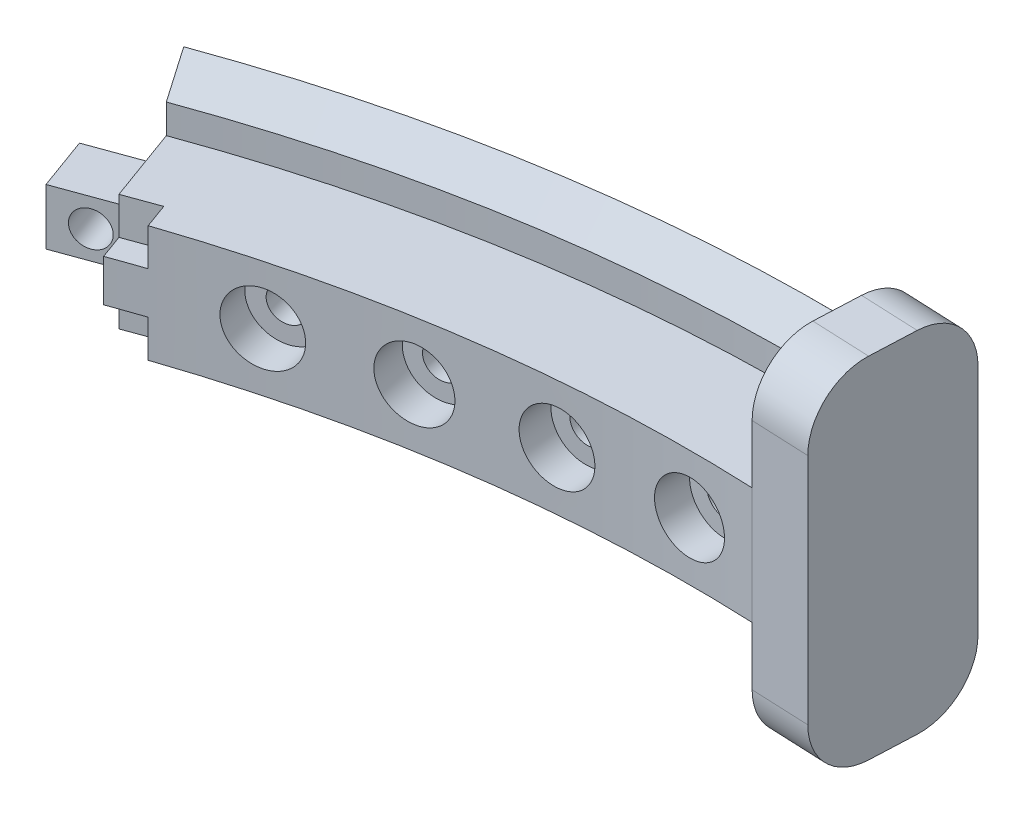
from build123d import *

# Parameters (mm, degrees)
REVOLVE_1_ANGLE          = 40
SKETCH_4_W               = 4.8
SKETCH_4_H               = 4.8
EXTRUDE_1_DEPTH          = 6
SKETCH_7_R               = 1.5
CUT_EXTRUDE_4_DEPTH      = 95.895882206
SKETCH_13_R              = 1.5
CUT_EXTRUDE_7_DEPTH      = 57.80711304
CUT_EXTRUDE_8_DEPTH      = 5
SKETCH_16_W              = 3
SKETCH_16_H              = 3
PATTERN_CIRCULAR_1_COUNT = 4
PATTERN_CIRCULAR_1_ANGLE = 15
SKETCH_10_W              = 2.2
SKETCH_10_H              = 5.2
CUT_EXTRUDE_5_DEPTH      = 3
SKETCH_11_W              = 47.375376564
SKETCH_11_H              = 32.407082742
CUT_EXTRUDE_6_DEPTH      = 149.607349927
SKETCH_12_W              = 14
SKETCH_12_H              = 30
EXTRUDE_2_DEPTH          = 5
FILLET_1_R               = 5


# Read off the part's stored shape, not the designer's step: 旋转1
with BuildPart() as part:
    # 旋转1 outline → 旋转1 (revolve)
    with BuildSketch(Plane(origin=(0, 0, 0), x_dir=(0.3420201433256701, 0, -0.9396926207859079), z_dir=(0.9396926207859079, 0, 0.3420201433256701))):
        Polygon((134, 5), (125, 5), (125, -5), (134, -5), (134, -7.5), (136.5, -10), (139, -7.5), (139, 7.5), (136.5, 10), (134, 7.5), align=None)
    revolve(axis=Axis((0, 0, 0), (0, 1, 0)), revolution_arc=REVOLVE_1_ANGLE)

    # 草图4 → 凸台-拉伸1 (add)
    with BuildSketch(Plane(origin=(0, 0, 0), x_dir=(0.3420201433256631, 0, 0.9396926207859104), z_dir=(-0.9396926207859104, 0, 0.3420201433256631))):
        with Locations((-132, 0)):
            Rectangle(SKETCH_4_W, SKETCH_4_H)
    extrude(amount=EXTRUDE_1_DEPTH)

    # 草图7 → 切除-拉伸4 (cut, through all)
    with BuildSketch(Plane(origin=(-45.967507263, 0, -126.294688234), x_dir=(-0.9396926207859105, 0, 0.3420201433256632), z_dir=(-0.3420201433256632, 0, -0.9396926207859105))):
        with Locations((3, 0)):
            Circle(SKETCH_7_R)
    extrude(amount=-CUT_EXTRUDE_4_DEPTH, mode=Mode.SUBTRACT)

    # 草图13 → 切除-拉伸7 (cut, through all)
    with BuildSketch(Plane(origin=(0, 0, -139), x_dir=(-1, 0, 0), z_dir=(0, 0, -1))):
        Circle(SKETCH_13_R)
    cut_extrude_7 = extrude(amount=-CUT_EXTRUDE_7_DEPTH, mode=Mode.SUBTRACT)

    # 草图14 → 切除-拉伸8 (cut)
    with BuildSketch(Plane(origin=(0, 0, -139), x_dir=(-1, 0, 0), z_dir=(0, 0, -1))):
        Polygon((0, -3.175426481), (2.75, -1.58771324), (2.75, 1.58771324), (0, 3.175426481), (-2.75, 1.58771324), (-2.75, -1.58771324), align=None)
    cut_extrude_8 = extrude(amount=-CUT_EXTRUDE_8_DEPTH, mode=Mode.SUBTRACT)

    # 草图16 → 切除-旋转1 (revolve, cut)
    with BuildSketch(Plane(origin=(0, 0, 0), x_dir=(1, 0, 0), z_dir=(0, 1, 0)), mode=Mode.PRIVATE) as cut_revolve_1_sk:
        with Locations((1.5, 126.463994814)):
            Rectangle(SKETCH_16_W, SKETCH_16_H)
    cut_revolve_1 = revolve(cut_revolve_1_sk.sketch.rotate(Axis((0, 0, 999.226836895), (0, 0, -1)), 180), axis=Axis((0, 0, 999.226836895), (0, 0, -1)), mode=Mode.SUBTRACT)

    # 阵列(圆周)1: 切除-拉伸7, 切除-拉伸8, 切除-旋转1 ×4 about axis
    pattern_circular_1_axis = Axis((0, 0, 0), (0, 1, 0))
    add([cut_extrude_7.rotate(pattern_circular_1_axis, i * PATTERN_CIRCULAR_1_ANGLE / (PATTERN_CIRCULAR_1_COUNT - 1)) for i in range(1, PATTERN_CIRCULAR_1_COUNT)], mode=Mode.SUBTRACT)
    add([cut_extrude_8.rotate(pattern_circular_1_axis, i * PATTERN_CIRCULAR_1_ANGLE / (PATTERN_CIRCULAR_1_COUNT - 1)) for i in range(1, PATTERN_CIRCULAR_1_COUNT)], mode=Mode.SUBTRACT)
    add([cut_revolve_1.rotate(pattern_circular_1_axis, i * PATTERN_CIRCULAR_1_ANGLE / (PATTERN_CIRCULAR_1_COUNT - 1)) for i in range(1, PATTERN_CIRCULAR_1_COUNT)], mode=Mode.SUBTRACT)

    # 草图10 → 切除-拉伸5 (cut)
    with BuildSketch(Plane(origin=(0, 0, 0), x_dir=(0.3420201433256631, 0, 0.9396926207859104), z_dir=(-0.9396926207859104, 0, 0.3420201433256631))):
        with Locations((-137.9, 0)):
            Rectangle(SKETCH_10_W, SKETCH_10_H)
        Polygon((-127.2, 5), (-125, 5), (-123.655375964, 5), (-123.655375964, 1.8), (-125, 1.8), (-127.2, 1.8), align=None)
        Polygon((-127.2, -1.8), (-125, -1.8), (-123.655375964, -1.8), (-123.655375964, -5), (-125, -5), (-127.2, -5), align=None)
    extrude(amount=-CUT_EXTRUDE_5_DEPTH, mode=Mode.SUBTRACT)

    # 草图11 → 切除-拉伸6 (cut, through all)
    with BuildSketch(Plane(origin=(0, 0, 0), x_dir=(0, -1, 0), z_dir=(0.9990482215818578, 0, 0.0436193873653361))):
        with Locations((-1.017262687, 125.577370773)):
            Rectangle(SKETCH_11_W, SKETCH_11_H)
    extrude(amount=CUT_EXTRUDE_6_DEPTH, mode=Mode.SUBTRACT)

    # 草图12 → 凸台-拉伸2 (add)
    with BuildSketch(Plane(origin=(0, 0, 0), x_dir=(0.043619387365336125, 0, -0.9990482215818578), z_dir=(0.9990482215818577, 0, 0.04361938736533612))):
        with Locations((132, 0)):
            Rectangle(SKETCH_12_W, SKETCH_12_H)
    extrude(amount=EXTRUDE_2_DEPTH)

    # 圆角1
    fillet_1_edges = [part.edges().sort_by_distance(p)[0] for p in [
        (7.950043975, 15, -124.771979229),
        (7.950043975, -15, -124.771979229),
        (8.560715398, -15, -138.758654331),
        (8.560715398, 15, -138.758654331),
    ]]
    fillet(fillet_1_edges, radius=FILLET_1_R)


solid = part.part
